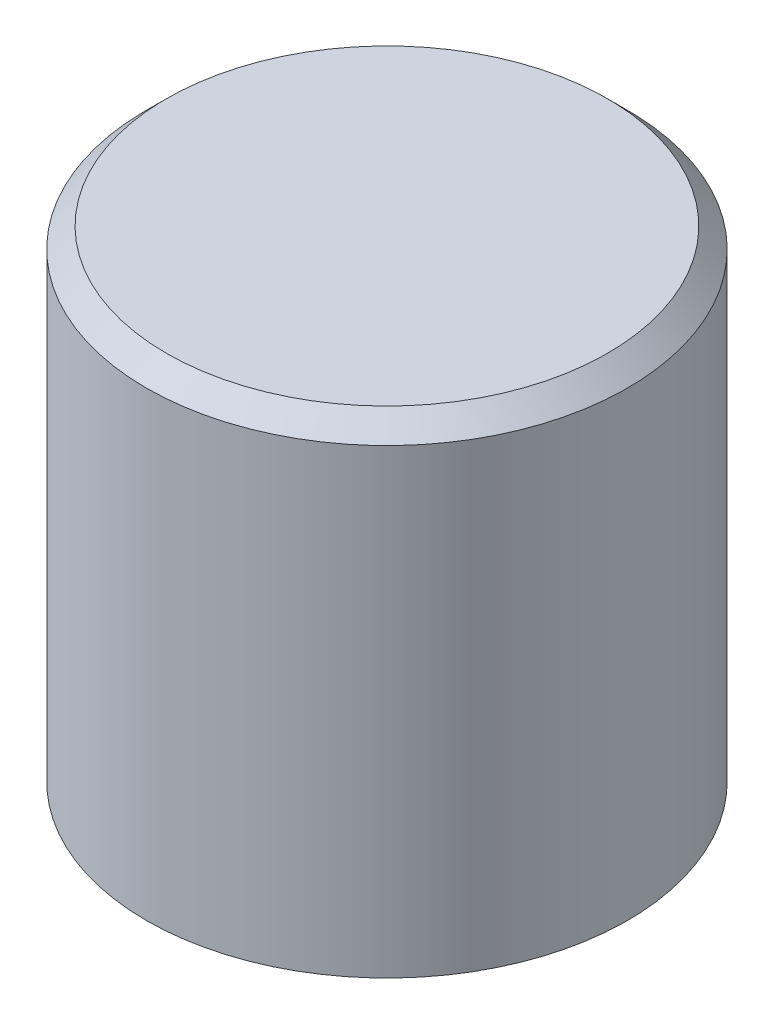
from build123d import *

# Parameters (mm, degrees)
CHAMFER1_SIZE  = 0.5
CHAMFER2_SIZE  = 0.1
CHAMFER2_SIZE2 = 0.123280305


with BuildPart() as part:
    # Sketch1 → Revolve2 (revolve)
    with BuildSketch(Plane.XY):
        Polygon((0, 12), (-6, 12), (-6, 0), (-5, 0), (-5, 3), (-1.5, 3.617144432), (-1.5, 8.5), (0, 8.5), align=None)
    revolve(axis=Axis((0, 0, 0), (0, -1, 0)))

    # Chamfer1
    chamfer1_edges = [part.edges().sort_by_distance(p)[0] for p in [
        (6, 12, 0),
    ]]
    chamfer(chamfer1_edges, length=CHAMFER1_SIZE)

    # Chamfer2
    chamfer2_edges = [part.edges().sort_by_distance(p)[0] for p in [
        (1.5, 3.617144432, 0),
    ]]
    chamfer2_side = [part.faces().sort_by_distance(p)[0] for p in [
        (1.5, 6.058572216, 0),
    ]]
    chamfer(chamfer2_edges, length=CHAMFER2_SIZE, length2=CHAMFER2_SIZE2, reference=chamfer2_side[0])


solid = part.part
